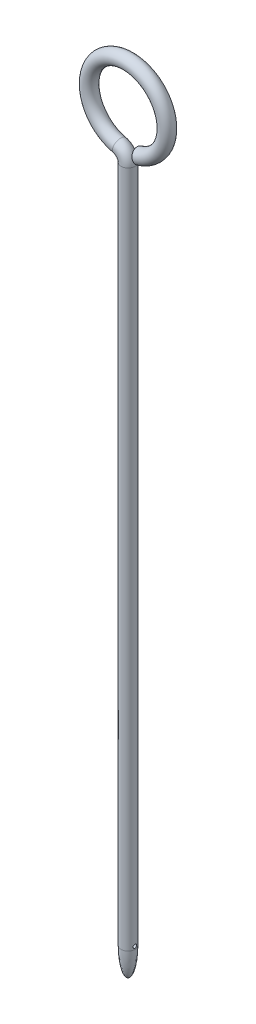
from build123d import *

# Parameters (mm, degrees)
SKETCH1_R               = 1.5875
BOSS_EXTRUDE1_DEPTH     = 152.4
SKETCH3_R               = 1.5875
DOME1_FACE_RADIUS       = 1.5875
DOME1_HEIGHT            = 6.35
CUT_EXTRUDE1_DEPTH      = 177.879432926
CUT_EXTRUDE1_DEPTH_BACK = 177.879432926
SKETCH5_R               = 0.396875


with BuildPart() as part:
    # Sketch1 → Boss-Extrude1 (new body)
    with BuildSketch(Plane(origin=(0, 0, 0), x_dir=(1, 0, 0), z_dir=(0, 1, 0))):
        Circle(SKETCH1_R)
    extrude(amount=BOSS_EXTRUDE1_DEPTH)

    # Sweep1: sweep along a path in Sketch2
    with BuildLine(Plane.XY) as sweep1_path:
        Line((0, 152.4), (0, 154.94))
        ThreePointArc((0, 154.94), (-0.554390662, 156.523968294), (-1.975555556, 157.416489949))
        ThreePointArc((-1.975555556, 157.416489949), (-0.291800096, 174.969414545), (2.54, 157.564785778))
    # Sketch3 → Sweep1 (sweep)
    with BuildSketch(Plane(origin=(0, 152.4, 0), x_dir=(1, 0, 0), z_dir=(0, 1, 0))):
        Circle(SKETCH3_R)
    sweep(path=sweep1_path.line)

    # Dome1: an elliptical dome of height H over a round flat face of radius A is half a spheroid: the quarter ellipse of half axes A and H revolved about the face's axis
    with BuildSketch(Plane((0, 0, 0), x_dir=(0, 0, 1), z_dir=(1, 0, 0)), mode=Mode.PRIVATE) as dome1_quarter:
        Ellipse(DOME1_FACE_RADIUS, DOME1_HEIGHT)
        Rectangle(DOME1_FACE_RADIUS, DOME1_HEIGHT, align=(Align.MIN, Align.MIN), mode=Mode.INTERSECT)
    revolve(dome1_quarter.sketch, axis=Axis((0, 0, 0), (0, -1, 0)))

    # Sketch5 → Cut-Extrude1 (cut, two sides: drawn at the far end of the back side and taken through both)
    with BuildSketch(Plane(origin=(0, 0, 0), x_dir=(0, 0, -1), z_dir=(1, 0, 0)).offset(-CUT_EXTRUDE1_DEPTH_BACK)):
        with Locations((0, 0.635)):
            Circle(SKETCH5_R)
    extrude(amount=CUT_EXTRUDE1_DEPTH + CUT_EXTRUDE1_DEPTH_BACK, mode=Mode.SUBTRACT)


solid = part.part
